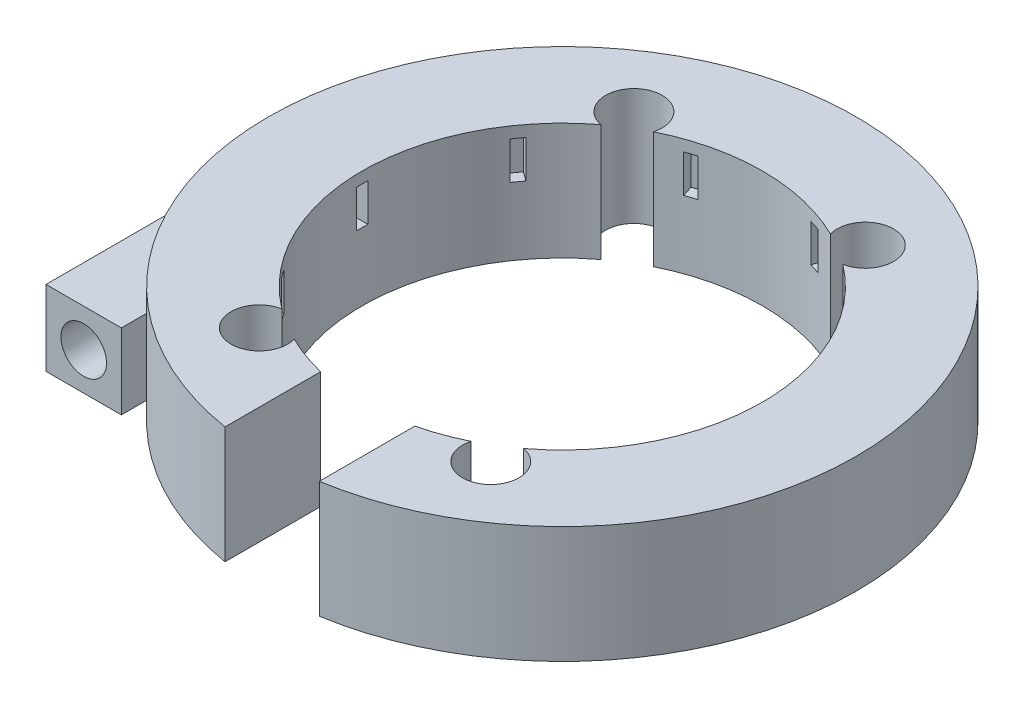
from build123d import *

# Parameters (mm, degrees)
BOSS_EXTRUDE1_DEPTH                    = 12.7
BOSS_EXTRUDE2_START                    = 1.524
BOSS_EXTRUDE2_DEPTH                    = 1.524
CUT_EXTRUDE1_START                     = -5.08
CUT_EXTRUDE1_DEPTH                     = 5.08
CIRPATTERN1_COUNT                      = 10
BOSS_EXTRUDE3_DEPTH                    = 1.524
BOSS_EXTRUDE4_REACH                    = 91.564
BOSS_EXTRUDE4_START                    = -31.75
SKETCH5_W                              = 10.16
SKETCH5_H                              = 10.16
PIPE_TAP_DRILL_FOR_1_16_TAP1_OUTLINE_W = 3.0734
PIPE_TAP_DRILL_FOR_1_16_TAP1_OUTLINE_H = 18.819417373


# Read off the part's stored shape, not the designer's step: Pipe Tap Drill for 1/16 Tap1
with BuildPart() as part:
    # Sketch1 → Boss-Extrude1 (new body)
    with BuildSketch(Plane(origin=(0, 0, 0), x_dir=(1, 0, 0), z_dir=(0, 1, 0))):
        with BuildLine():
            Line((-6.35, -39.111876406), (-6.35, -26.229804731))
            ThreePointArc((-6.35, -26.229804731), (-9.195968421, -25.372412598), (-11.930388818, -24.207250544))
            ThreePointArc((-11.930388818, -24.207250544), (-17.597866727, -28.489054604), (-16.305991261, -21.504413623))
            ThreePointArc((-16.305991261, -21.504413623), (-26.9875, 0), (-16.305991261, 21.504413623))
            ThreePointArc((-16.305991261, 21.504413623), (-17.597866727, 28.489054604), (-11.930388818, 24.207250544))
            ThreePointArc((-11.930388818, 24.207250544), (0, 26.9875), (11.930388818, 24.207250544))
            ThreePointArc((11.930388818, 24.207250544), (17.597866727, 28.489054604), (16.305991261, 21.504413623))
            ThreePointArc((16.305991261, 21.504413623), (25.931572766, 7.475205023), (25.250733281, -9.525))
            ThreePointArc((25.250733281, -9.525), (21.624452048, -16.146461838), (16.305991261, -21.504413623))
            ThreePointArc((16.305991261, -21.504413623), (17.597866727, -28.489054604), (11.930388818, -24.207250544))
            ThreePointArc((11.930388818, -24.207250544), (9.195968421, -25.372412598), (6.35, -26.229804731))
            Line((6.35, -26.229804731), (6.35, -39.111876406))
            ThreePointArc((6.35, -39.111876406), (0, 39.624), (-6.35, -39.111876406))
        make_face()
        with BuildLine():
            ThreePointArc((-10.420309243, -26.539080382), (-8.907325286, -27.084408587), (-7.366, -27.543559615))
            Line((-7.366, -27.543559615), (-7.366, -37.38117232))
            ThreePointArc((-7.366, -37.38117232), (0, 38.1), (7.366, -37.38117232))
            Line((7.366, -37.38117232), (7.366, -27.543559615))
            ThreePointArc((7.366, -27.543559615), (8.907325286, -27.084408587), (10.420309243, -26.539080382))
            ThreePointArc((10.420309243, -26.539080382), (18.398773418, -29.785636446), (19.067117112, -21.197893228))
            ThreePointArc((19.067117112, -21.197893228), (27.63343957, -7.021299722), (26.873407064, 9.525))
            ThreePointArc((26.873407064, 9.525), (23.700148723, 15.849560965), (19.067117112, 21.197893228))
            ThreePointArc((19.067117112, 21.197893228), (18.398773418, 29.785636446), (10.420309243, 26.539080382))
            ThreePointArc((10.420309243, 26.539080382), (0, 28.5115), (-10.420309243, 26.539080382))
            ThreePointArc((-10.420309243, 26.539080382), (-18.398773418, 29.785636446), (-19.067117112, 21.197893228))
            ThreePointArc((-19.067117112, 21.197893228), (-28.5115, 0), (-19.067117112, -21.197893228))
            ThreePointArc((-19.067117112, -21.197893228), (-18.398773418, -29.785636446), (-10.420309243, -26.539080382))
        make_face(mode=Mode.SUBTRACT)
    extrude(amount=BOSS_EXTRUDE1_DEPTH)

    # Sketch2 → Boss-Extrude2 (add)
    with BuildSketch(Plane.XZ.offset(BOSS_EXTRUDE2_START)):
        with BuildLine():
            Line((-6.35, 26.229804731), (-6.35, 39.111876406))
            ThreePointArc((-6.35, 39.111876406), (0, -39.624), (6.35, 39.111876406))
            Line((6.35, 39.111876406), (6.35, 26.229804731))
            ThreePointArc((6.35, 26.229804731), (9.195968421, 25.372412598), (11.930388818, 24.207250544))
            ThreePointArc((11.930388818, 24.207250544), (17.597866727, 28.489054604), (16.305991261, 21.504413623))
            ThreePointArc((16.305991261, 21.504413623), (26.9875, 0), (16.305991261, -21.504413623))
            ThreePointArc((16.305991261, -21.504413623), (17.597866727, -28.489054604), (11.930388818, -24.207250544))
            ThreePointArc((11.930388818, -24.207250544), (0, -26.9875), (-11.930388818, -24.207250544))
            ThreePointArc((-11.930388818, -24.207250544), (-17.597866727, -28.489054604), (-16.305991261, -21.504413623))
            ThreePointArc((-16.305991261, -21.504413623), (-26.9875, 0), (-16.305991261, 21.504413623))
            ThreePointArc((-16.305991261, 21.504413623), (-17.597866727, 28.489054604), (-11.930388818, 24.207250544))
            ThreePointArc((-11.930388818, 24.207250544), (-9.195968421, 25.372412598), (-6.35, 26.229804731))
        make_face()
    extrude(amount=-BOSS_EXTRUDE2_DEPTH)

    # Sketch3 → Cut-Extrude1 (cut)
    with BuildSketch(Plane(origin=(0, 12.7, 0), x_dir=(1, 0, 0), z_dir=(0, 1, 0)).offset(CUT_EXTRUDE1_START)):
        with BuildLine():
            Line((26.976740208, 0.762), (28.501315553, 0.762))
            ThreePointArc((28.501315553, 0.762), (28.5115, 0), (28.501315553, -0.762))
            Line((28.501315553, -0.762), (26.976740208, -0.762))
            ThreePointArc((26.976740208, -0.762), (26.9875, 0), (26.976740208, 0.762))
        make_face()
    cut_extrude1 = extrude(amount=CUT_EXTRUDE1_DEPTH, mode=Mode.SUBTRACT)

    # CirPattern1: Cut-Extrude1 ×10 about axis
    cirpattern1_axis = Axis((0, 0, 0), (0, 1, 0))
    for i in range(1, CIRPATTERN1_COUNT):
        add(cut_extrude1.rotate(cirpattern1_axis, i * 360 / CIRPATTERN1_COUNT), mode=Mode.SUBTRACT)

    # Sketch4 → Boss-Extrude3 (add)
    with BuildSketch(Plane(origin=(0, 12.7, 0), x_dir=(1, 0, 0), z_dir=(0, 1, 0))):
        with BuildLine():
            Line((-6.35, -39.111876406), (-6.35, -26.229804731))
            ThreePointArc((-6.35, -26.229804731), (-9.195968421, -25.372412598), (-11.930388818, -24.207250544))
            ThreePointArc((-11.930388818, -24.207250544), (-17.597866727, -28.489054604), (-16.305991261, -21.504413623))
            ThreePointArc((-16.305991261, -21.504413623), (-26.9875, 0), (-16.305991261, 21.504413623))
            ThreePointArc((-16.305991261, 21.504413623), (-17.597866727, 28.489054604), (-11.930388818, 24.207250544))
            ThreePointArc((-11.930388818, 24.207250544), (0, 26.9875), (11.930388818, 24.207250544))
            ThreePointArc((11.930388818, 24.207250544), (17.597866727, 28.489054604), (16.305991261, 21.504413623))
            ThreePointArc((16.305991261, 21.504413623), (26.9875, 0), (16.305991261, -21.504413623))
            ThreePointArc((16.305991261, -21.504413623), (17.597866727, -28.489054604), (11.930388818, -24.207250544))
            ThreePointArc((11.930388818, -24.207250544), (9.195968421, -25.372412598), (6.35, -26.229804731))
            Line((6.35, -26.229804731), (6.35, -39.111876406))
            ThreePointArc((6.35, -39.111876406), (0, 39.624), (-6.35, -39.111876406))
        make_face()
    extrude(amount=BOSS_EXTRUDE3_DEPTH)


with BuildPart() as body_2:

    # Sketch5 → Boss-Extrude4 (new, up to next)
    with BuildSketch(Plane(origin=(0, 0, 0), x_dir=(-1, 0, 0), z_dir=(0, 0, -1)).offset(BOSS_EXTRUDE4_START), mode=Mode.PRIVATE) as boss_extrude4_sk1:
        with Locations((32.764659515, 6.35)):
            Rectangle(SKETCH5_W, SKETCH5_H)
    boss_extrude4_tool1 = extrude(boss_extrude4_sk1.sketch, amount=BOSS_EXTRUDE4_REACH, mode=Mode.PRIVATE) - part.part
    add(boss_extrude4_tool1.solids().sort_by_distance((-32.76466, 6.35, 31.75))[0])


with BuildPart() as pipe_tap_drill_for_1_16_tap1_tool:
    # Pipe Tap Drill for 1/16 Tap1 outline → Pipe Tap Drill for 1/16 Tap1 (revolve)
    with BuildSketch(Plane(origin=(-32.764659515, 6.316095099, 0), x_dir=(1, 0, 0), z_dir=(0, -1, 0))):
        with Locations((1.5367, 22.340291314)):
            Rectangle(PIPE_TAP_DRILL_FOR_1_16_TAP1_OUTLINE_W, PIPE_TAP_DRILL_FOR_1_16_TAP1_OUTLINE_H)
    revolve(axis=Axis((-32.764659515, 6.316095099, 0), (0, 0, 1)))


with BuildPart() as part_1:
    add(part.part)

    # Pipe Tap Drill for 1/16 Tap1: cut by pipe_tap_drill_for_1_16_tap1_tool
    add(pipe_tap_drill_for_1_16_tap1_tool.part, mode=Mode.SUBTRACT)


with BuildPart() as body_2_1:
    add(body_2.part)

    # Pipe Tap Drill for 1/16 Tap1: cut by pipe_tap_drill_for_1_16_tap1_tool
    add(pipe_tap_drill_for_1_16_tap1_tool.part, mode=Mode.SUBTRACT)


solid = Compound([part_1.part, body_2_1.part])
